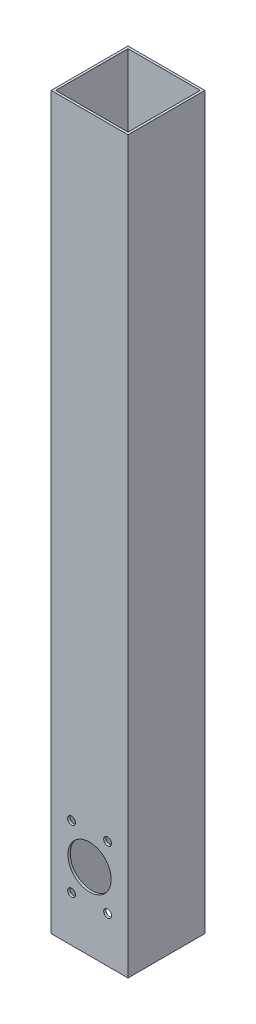
from build123d import *

# Parameters (mm, degrees)
SKETCH1_W               = 50.8
SKETCH1_H               = 50.8
SKETCH1_W_2             = 47.752
SKETCH1_H_2             = 47.752
EXTRUDE_THIN1_DEPTH     = 482.6
CUT_EXTRUDE1_DEPTH      = 484.934995635
CUT_EXTRUDE1_DEPTH_BACK = 484.934995635
SKETCH2_R               = 14.3002
SKETCH2_R_2             = 2.5908


with BuildPart() as part:
    # Sketch1 → Extrude-Thin1 (new body)
    with BuildSketch(Plane(origin=(0, 0, 0), x_dir=(1, 0, 0), z_dir=(0, 1, 0))):
        Rectangle(SKETCH1_W, SKETCH1_H)
        Rectangle(SKETCH1_W_2, SKETCH1_H_2, mode=Mode.SUBTRACT)
    extrude(amount=EXTRUDE_THIN1_DEPTH)

    # Sketch2 → Cut-Extrude1 (cut, two sides: drawn at the far end of the back side and taken through both)
    with BuildSketch(Plane.XY.offset(-CUT_EXTRUDE1_DEPTH_BACK)):
        with Locations((0, 50.8)):
            Circle(SKETCH2_R)
        with Locations((-11.9126, 30.16677155)):
            Circle(SKETCH2_R_2)
        with Locations((11.9126, 30.16677155)):
            Circle(SKETCH2_R_2)
        with Locations((11.9126, 71.43322845)):
            Circle(SKETCH2_R_2)
        with Locations((-11.9126, 71.43322845)):
            Circle(SKETCH2_R_2)
    extrude(amount=CUT_EXTRUDE1_DEPTH + CUT_EXTRUDE1_DEPTH_BACK, mode=Mode.SUBTRACT)


solid = part.part
